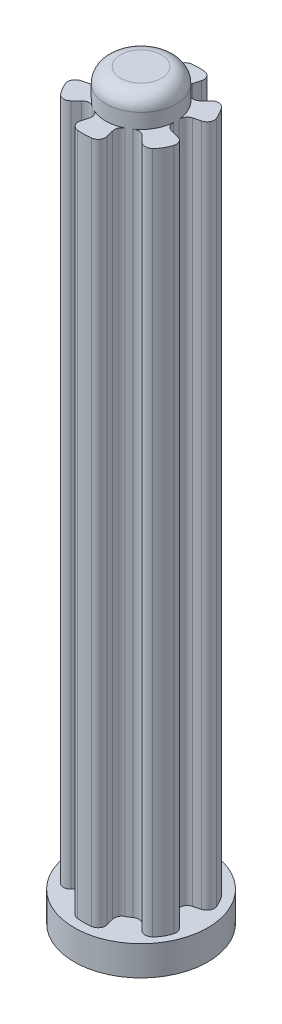
from build123d import *

# Parameters (mm, degrees)
BOSS_EXTRUDE1_DEPTH = 46
SKETCH3_R           = 4.5
BOSS_EXTRUDE2_DEPTH = 2
SKETCH4_R           = 2.375
BOSS_EXTRUDE3_DEPTH = 2
FILLET1_R           = 0.5
SKETCH6_R           = 1
CUT_EXTRUDE4_DEPTH  = 0.5
CUT_EXTRUDE4_DRAFT  = -50
FILLET2_R           = 1


with BuildPart() as part:
    # Sketch2 → Boss-Extrude1 (new body)
    with BuildSketch(Plane(origin=(0, 0, 0), x_dir=(1, 0, 0), z_dir=(0, 1, 0))):
        with BuildLine():
            Line((3.775215965, -0.978645895), (2.300774305, -0.58912019))
            ThreePointArc((2.300774305, -0.58912019), (2.374963211, 0.013219106), (2.294073837, 0.614695232))
            Line((2.294073837, 0.614695232), (3.742962577, 1.0029238))
            ThreePointArc((3.742962577, 1.0029238), (3.356294138, 1.936727823), (2.741299364, 2.73877761))
            Line((2.741299364, 2.73877761), (1.680151223, 1.678605632))
            ThreePointArc((1.680151223, 1.678605632), (1.187973207, 2.056537055), (0.614695232, 2.294073837))
            Line((0.614695232, 2.294073837), (1.0029238, 3.742962577))
            ThreePointArc((1.0029238, 3.742962577), (0, 3.875), (-1.0029238, 3.742962577))
            Line((-1.0029238, 3.742962577), (-0.614695232, 2.294073837))
            ThreePointArc((-0.614695232, 2.294073837), (-1.1875, 2.056810334), (-1.679378605, 1.679378605))
            Line((-1.679378605, 1.679378605), (-2.740038777, 2.740038777))
            ThreePointArc((-2.740038777, 2.740038777), (-3.35584844, 1.9375), (-3.742962577, 1.0029238))
            Line((-3.742962577, 1.0029238), (-2.294073837, 0.614695232))
            ThreePointArc((-2.294073837, 0.614695232), (-2.375, 0), (-2.294073837, -0.614695232))
            Line((-2.294073837, -0.614695232), (-3.742962577, -1.0029238))
            ThreePointArc((-3.742962577, -1.0029238), (-3.35584844, -1.9375), (-2.740038777, -2.740038777))
            Line((-2.740038777, -2.740038777), (-1.679378605, -1.679378605))
            ThreePointArc((-1.679378605, -1.679378605), (-1.1875, -2.056810334), (-0.614695232, -2.294073837))
            Line((-0.614695232, -2.294073837), (-1.0029238, -3.742962577))
            ThreePointArc((-1.0029238, -3.742962577), (0.033967076, -3.874851125), (1.068386506, -3.724805401))
            Line((1.068386506, -3.724805401), (0.681359786, -2.275164575))
            ThreePointArc((0.681359786, -2.275164575), (1.238849907, -2.026296106), (1.714477211, -1.643530618))
            Line((1.714477211, -1.643530618), (2.767163136, -2.698133353))
            ThreePointArc((2.767163136, -2.698133353), (3.500652231, -1.972912562), (3.775215965, -0.978645895))
        make_face()
        Polygon((0.085836926, -0.044584082), (0, 0), (0.073933818, 0), (0.104207494, -0.030328801), (0.080162685, -0.023330742), align=None, mode=Mode.SUBTRACT)
    extrude(amount=BOSS_EXTRUDE1_DEPTH)

    # Sketch3 → Boss-Extrude2 (add)
    with BuildSketch(Plane.XZ):
        with Locations(Location((0, 0, 0), (0, 0, 270))):
            Circle(SKETCH3_R)
    extrude(amount=BOSS_EXTRUDE2_DEPTH)

    # Sketch4 → Boss-Extrude3 (add)
    with BuildSketch(Plane(origin=(0, 46, 0), x_dir=(1, 0, 0), z_dir=(0, 1, 0))):
        with Locations(Location((0, 0, 0), (0, 0, 75))):
            Circle(SKETCH4_R)
    extrude(amount=BOSS_EXTRUDE3_DEPTH)

    # Fillet1
    # the kernel refuses this fillet: 0.5 mm, written as the material it adds along each edge
    with BuildSketch(Plane(origin=(-2.294073837, -1.140469783, 0.614695232), x_dir=(-0.965925826289068, 0, 0.2588190451025218), z_dir=(0, 1, 0)), Plane(origin=(-1.679378605, -1.140469783, -1.679378605), x_dir=(-0.7071067811865478, 0, -0.7071067811865474), z_dir=(0, 1, 0)), Plane(origin=(0.614695232, -1.140469783, -2.294073837), x_dir=(0.2588190451025215, 0, -0.9659258262890681), z_dir=(0, 1, 0)), Plane(origin=(2.294073837, -1.140469783, -0.614695232), x_dir=(0.9659258262890681, 0, -0.2588190451025215), z_dir=(0, 1, 0)), Plane(origin=(-0.614695232, -1.140469783, 2.294073837), x_dir=(-0.2588190451025215, 0, 0.9659258262890681), z_dir=(0, 1, 0))) as fillet1_piece_1:
        with BuildLine():
            CenterArc((0.456187913, -0.5), FILLET1_R, 90, 79.984589832)
            ThreePointArc((-0.036192593, -0.413043478), (-0.00906545, -0.20731306), (0, 0))
            Line((0, 0), (0.456187913, 0))
        make_face()
    extrude(amount=47.140469783)
    with BuildSketch(Plane(origin=(-2.294073837, -1.140469783, -0.614695232), x_dir=(-0.17351574004952178, 0, 0.9848310961556133), z_dir=(0, 1, 0)), Plane(origin=(-1.679378605, -1.140469783, 1.679378605), x_dir=(0.7661308776828862, 0, 0.6426845869171364), z_dir=(0, 1, 0))) as fillet1_piece_2:
        with BuildLine():
            CenterArc((0.458270974, -0.498091484), FILLET1_R, 95.007705084, 79.984589832)
            Line((-0.03982051, -0.45444663), (0, 0))
            ThreePointArc((0, 0), (0.20731306, -0.00906545), (0.414626119, 0))
        make_face()
    extrude(amount=47.140469783)
    with BuildSketch(Plane(origin=(-0.614695232, -1.140469783, -2.294073837), x_dir=(-0.258819045102522, 0, -0.965925826289068), z_dir=(0, 1, 0)), Plane(origin=(1.680151223, -1.140469783, -1.678605632), x_dir=(0.707432093873984, 0, -0.7067813187663288), z_dir=(0, 1, 0))) as fillet1_piece_3:
        with BuildLine():
            CenterArc((0.456187913, 0.5), FILLET1_R, 190.015410168, 79.984589832)
            ThreePointArc((-0.036192593, 0.413043478), (-0.00906545, 0.20731306), (0, 0))
            Line((0, 0), (0.456187913, 0))
        make_face()
    extrude(amount=47.140469783)
    with BuildSketch(Plane(origin=(2.300774305, -1.132506036, 0.58912019), x_dir=(0.16314582309469597, 0, -0.9866019665532569), z_dir=(0, 1, 0))) as fillet1_piece_4:
        with BuildLine():
            CenterArc((0.455070929, -0.498118095), FILLET1_R, 94.972648578, 79.61829146)
            Line((-0.042702606, -0.450985227), (0, 0))
            ThreePointArc((0, 0), (0.20586542, -0.008939048), (0.411730841, 0))
        make_face()
    extrude(amount=47.132506036)
    with BuildSketch(Plane(origin=(1.714477211, -1.163771178, 1.643530618), x_dir=(0.7064632978713467, 0, 0.7077496794494088), z_dir=(0, 1, 0))) as fillet1_piece_5:
        with BuildLine():
            CenterArc((0.465508471, -0.5), FILLET1_R, 90, 81.041880237)
            ThreePointArc((-0.02839274, -0.422143763), (-0.00477723, -0.211705398), (0, 0))
            Line((0, 0), (0.465508471, 0))
        make_face()
    extrude(amount=47.163771178)
    with BuildSketch(Plane(origin=(0.681359786, -1.109284133, 2.275164575), x_dir=(0.9301474254657973, 0, -0.3671862836481626), z_dir=(0, 1, 0))) as fillet1_piece_6:
        with BuildLine():
            CenterArc((0.445739753, -0.498194619), FILLET1_R, 94.870436099, 78.535607624)
            Line((-0.050952689, -0.440778436), (0, 0))
            ThreePointArc((0, 0), (0.201644174, -0.008575561), (0.403288348, 0))
        make_face()
    extrude(amount=47.109284133)
    # the kernel refuses this fillet: 0.5 mm, written as the material it takes off along each edge
    with BuildSketch(Plane(origin=(-2.740038777, 0, 2.740038777), x_dir=(-0.6526300069150477, 0, -0.7576767609436524), z_dir=(0, 1, 0)), Plane(origin=(-3.742962577, 0, -1.0029238), x_dir=(0.32985231937679765, 0, -0.9440325457322681), z_dir=(0, 1, 0)), Plane(origin=(-1.0029238, 0, -3.742962577), x_dir=(0.982482326291838, 0, -0.18635578478860887), z_dir=(0, 1, 0)), Plane(origin=(2.741299364, 0, -2.73877761), x_dir=(0.6522812796019254, 0, 0.7579769998363239), z_dir=(0, 1, 0))) as fillet1_2_piece_1:
        with BuildLine():
            CenterArc((0.538524723, -0.49861874), FILLET1_R, 85.740187873, 98.519624254)
            Line((0.039905983, -0.535758376), (0, 0))
            ThreePointArc((0, 0), (0.287832179, 0.010704768), (0.575664359, 0))
        make_face()
    extrude(amount=47.439160897, mode=Mode.SUBTRACT)
    with BuildSketch(Plane(origin=(-3.742962577, 0, 1.0029238), x_dir=(0.9659258262890679, 0, -0.2588190451025218), z_dir=(0, 1, 0)), Plane(origin=(-2.740038777, 0, -2.740038777), x_dir=(0.7071067811865476, 0, 0.7071067811865476), z_dir=(0, 1, 0)), Plane(origin=(1.0029238, 0, -3.742962577), x_dir=(-0.25881904510252196, 0, 0.965925826289068), z_dir=(0, 1, 0)), Plane(origin=(3.742962577, 0, -1.0029238), x_dir=(-0.9659258262890681, 0, 0.25881904510252185), z_dir=(0, 1, 0)), Plane(origin=(-1.0029238, 0, 3.742962577), x_dir=(0.2588190451025216, 0, -0.9659258262890681), z_dir=(0, 1, 0))) as fillet1_2_piece_2:
        with BuildLine():
            CenterArc((0.537242519, -0.5), FILLET1_R, 90, 98.519624254)
            ThreePointArc((0.04275993, -0.574074074), (0.010704768, -0.287832179), (0, 0))
            Line((0, 0), (0.537242519, 0))
        make_face()
    extrude(amount=47.439160897, mode=Mode.SUBTRACT)
    with BuildSketch(Plane(origin=(3.775215965, 0, 0.978645895), x_dir=(-0.13498089829276533, 0, 0.9908482008340522), z_dir=(0, 1, 0))) as fillet1_2_piece_3:
        with BuildLine():
            CenterArc((0.442538799, -0.49598715), FILLET1_R, 82.736098253, 90.22281865)
            Line((-0.053690457, -0.434696649), (0, 0))
            ThreePointArc((0, 0), (0.252879314, 0.016051399), (0.505758627, 0))
        make_face()
    extrude(amount=47.264396568, mode=Mode.SUBTRACT)
    with BuildSketch(Plane(origin=(2.767163136, 0, 2.698133353), x_dir=(0.8000663385432955, 0, -0.5999115384203949), z_dir=(0, 1, 0))) as fillet1_2_piece_4:
        with BuildLine():
            CenterArc((0.434547354, 0.496131331), FILLET1_R, 188.084320914, 89.047719887)
            Line((-0.060483736, 0.425816179), (0, 0))
            ThreePointArc((0, 0), (0.248312773, -0.015474675), (0.496625547, 0))
        make_face()
    extrude(amount=47.241563867, mode=Mode.SUBTRACT)
    with BuildSketch(Plane(origin=(1.068386506, 0, 3.724805401), x_dir=(-0.9787647804449897, 0, 0.20498659605074468), z_dir=(0, 1, 0))) as fillet1_2_piece_5:
        with BuildLine():
            CenterArc((0.527919562, -0.498672678), FILLET1_R, 85.824226653, 97.295295094)
            Line((0.028660468, -0.525882193), (0, 0))
            ThreePointArc((0, 0), (0.282163904, 0.010286747), (0.564327807, 0))
        make_face()
    extrude(amount=47.410819518, mode=Mode.SUBTRACT)


with BuildPart() as cut_extrude4_tool:
    # Sketch6 → Cut-Extrude4 (with draft: the straight prism first)
    with BuildSketch(Plane.XZ.offset(2)):
        Circle(SKETCH6_R)
    extrude(amount=-CUT_EXTRUDE4_DEPTH)
    # Cut-Extrude4: the draft: its side faces are tilted about the plane it starts from
    cut_extrude4_sides = [cut_extrude4_tool.faces().sort_by_distance(p)[0] for p in [
        (-1, -1.75, 0),
    ]]
    draft(cut_extrude4_sides, Plane.XZ.offset(2), CUT_EXTRUDE4_DRAFT)


with BuildPart() as part_1:
    add(part.part)

    # Cut-Extrude4: cut by cut_extrude4_tool
    add(cut_extrude4_tool.part, mode=Mode.SUBTRACT)

    # Fillet2
    fillet2_edges = [part_1.edges().sort_by_distance(p)[0] for p in [
        (-0.614695232, 48, 2.294073837),
    ]]
    fillet(fillet2_edges, radius=FILLET2_R)


solid = part_1.part
